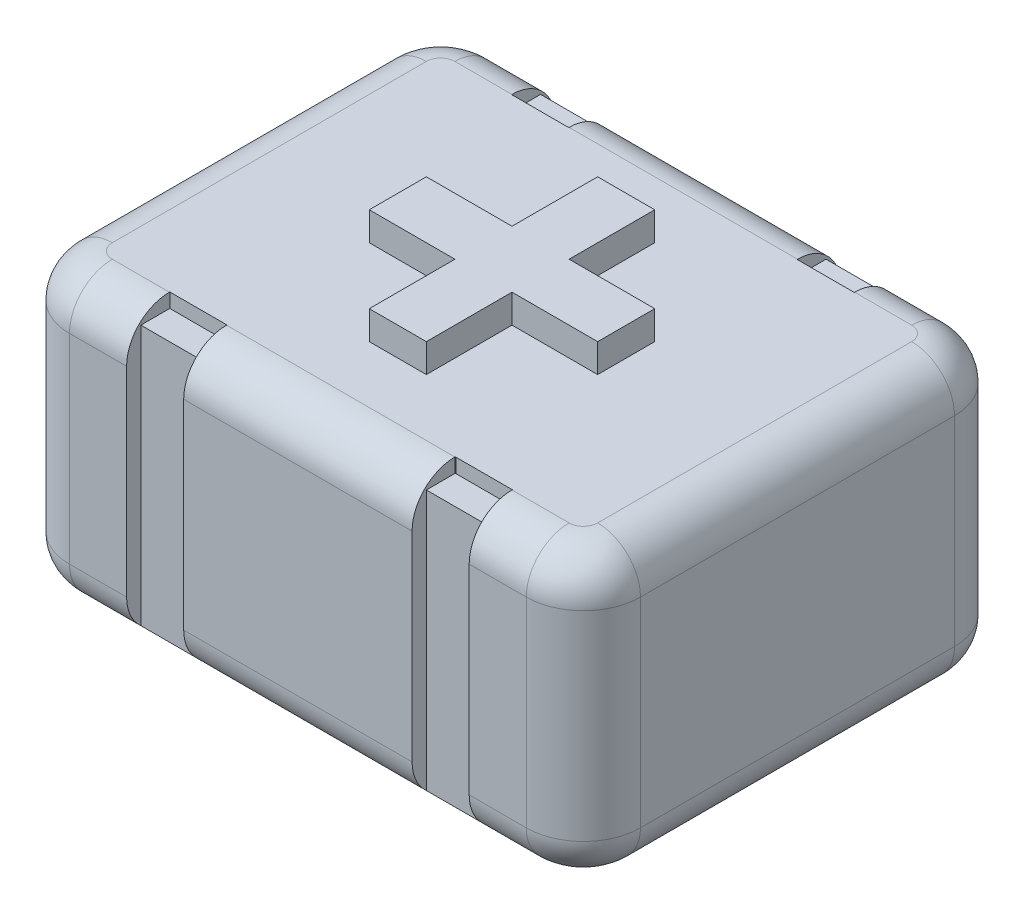
from build123d import *

# Parameters (mm, degrees)
BOSS_EXTRUDE1_DEPTH = 10
SKETCH2_W           = 2
SKETCH2_H           = 0.5
CUT_EXTRUDE1_DEPTH  = 10
CUT_EXTRUDE2_DEPTH  = 0.5
FILLET1_R           = 1.5
FILLET2_R           = 1.5
BOSS_EXTRUDE2_DEPTH = 1


with BuildPart() as part:
    # Sketch1 → Boss-Extrude1 (new body)
    with BuildSketch(Plane(origin=(0, 0, 0), x_dir=(1, 0, 0), z_dir=(0, 1, 0))):
        with BuildLine():
            Line((-8, 7.5), (8, 7.5))
            ThreePointArc((8, 7.5), (9.414213562, 6.914213562), (10, 5.5))
            Line((10, 5.5), (10, -5.5))
            ThreePointArc((10, -5.5), (9.414213562, -6.914213562), (8, -7.5))
            Line((8, -7.5), (-8, -7.5))
            ThreePointArc((-8, -7.5), (-9.414213562, -6.914213562), (-10, -5.5))
            Line((-10, -5.5), (-10, 5.5))
            ThreePointArc((-10, 5.5), (-9.414213562, 6.914213562), (-8, 7.5))
        make_face()
    extrude(amount=BOSS_EXTRUDE1_DEPTH)

    # Sketch2 → Cut-Extrude1 (cut)
    with BuildSketch(Plane(origin=(0, 10, 0), x_dir=(1, 0, 0), z_dir=(0, 1, 0))):
        with Locations((-5, 7.25)):
            Rectangle(SKETCH2_W, SKETCH2_H)
        with Locations((5, 7.25)):
            Rectangle(SKETCH2_W, SKETCH2_H)
        with Locations((5, -7.25)):
            Rectangle(SKETCH2_W, SKETCH2_H)
        with Locations((-5, -7.25)):
            Rectangle(SKETCH2_W, SKETCH2_H)
    extrude(amount=-CUT_EXTRUDE1_DEPTH, mode=Mode.SUBTRACT)

    # Sketch3 → Cut-Extrude2 (cut)
    with BuildSketch(Plane(origin=(0, 10, 0), x_dir=(1, 0, 0), z_dir=(0, 1, 0))):
        Polygon((-6, 7), (-6, 5.986822399), (-4.02260562, 5.986822399), (-4, 6), (-4, 7), align=None)
        Polygon((4, 7), (4, 6), (4.02260562, 5.986822399), (6, 5.986822399), (6, 7), align=None)
        Polygon((6, -7), (4, -7), (4, -6), (4.02260562, -5.986822399), (6, -5.986822399), align=None)
        Polygon((-4, -7), (-4, -6), (-4.02260562, -5.986822399), (-6, -5.986822399), (-6, -7), align=None)
    extrude(amount=-CUT_EXTRUDE2_DEPTH, mode=Mode.SUBTRACT)

    # Fillet1
    fillet1_edges = [part.edges().sort_by_distance(p)[0] for p in [
        (-9.414213562, 10, 6.914213562),
        (-10, 10, 0),
        (-9.414213562, 10, -6.914213562),
        (7, 10, -7.5),
        (-7, 10, -7.5),
        (9.414213562, 10, -6.914213562),
        (10, 10, 0),
        (9.414213562, 10, 6.914213562),
        (7, 10, 7.5),
        (-7, 10, 7.5),
        (0, 10, 7.5),
        (0, 10, -7.5),
    ]]
    fillet(fillet1_edges, radius=FILLET1_R)

    # Fillet2
    # the kernel refuses this fillet: 1.5 mm, written as the material it takes off along each edge
    with BuildSketch(Plane(origin=(2.25, 0, -7.5), x_dir=(0, 0, 1), z_dir=(1, 0, 0)), Plane(origin=(8, 0, 7.5), x_dir=(0, 0, -1), z_dir=(-1, 0, 0)), Plane(origin=(-2.25, 0, 7.5), x_dir=(0, 0, -1), z_dir=(-1, 0, 0))) as fillet2_piece_1:
        with BuildLine():
            CenterArc((FILLET2_R, -FILLET2_R), FILLET2_R, 90, 90)
            Line((0, -FILLET2_R), (0, 0))
            Line((0, 0), (FILLET2_R, 0))
        make_face()
    extrude(amount=5.75, mode=Mode.SUBTRACT)
    with BuildSketch(Plane(origin=(8, 0, -5.5), x_dir=(0, 0, -1), z_dir=(-1, 0, 0))) as fillet2_piece_2:
        with BuildLine():
            CenterArc((2 - FILLET2_R, -FILLET2_R), FILLET2_R, 0, 90)
            Line((2, -FILLET2_R), (2, 0))
            Line((2, 0), (2 - FILLET2_R, 0))
        make_face()
    revolve(axis=Axis((8, 0, -5.5), (0, -1, 0)), revolution_arc=90, mode=Mode.SUBTRACT)
    with BuildSketch(Plane(origin=(10, 0, -5.5), x_dir=(-1, 0, 0), z_dir=(0, 0, 1)), Plane(origin=(-10, 0, 5.5), x_dir=(1, 0, 0), z_dir=(0, 0, -1))) as fillet2_piece_3:
        with BuildLine():
            CenterArc((FILLET2_R, -FILLET2_R), FILLET2_R, 90, 90)
            Line((0, -FILLET2_R), (0, 0))
            Line((0, 0), (FILLET2_R, 0))
        make_face()
    extrude(amount=11, mode=Mode.SUBTRACT)
    with BuildSketch(Plane(origin=(8, 0, 5.5), x_dir=(1, 0, 0), z_dir=(0, 0, -1))) as fillet2_piece_4:
        with BuildLine():
            CenterArc((2 - FILLET2_R, -FILLET2_R), FILLET2_R, 0, 90)
            Line((2, -FILLET2_R), (2, 0))
            Line((2, 0), (2 - FILLET2_R, 0))
        make_face()
    revolve(axis=Axis((8, 0, 5.5), (0, -1, 0)), revolution_arc=90, mode=Mode.SUBTRACT)
    with BuildSketch(Plane(origin=(7.75, 0, 7.5), x_dir=(0, 0, -1), z_dir=(-1, 0, 0)), Plane(origin=(-7.75, 0, -7.5), x_dir=(0, 0, 1), z_dir=(1, 0, 0))) as fillet2_piece_5:
        with BuildLine():
            CenterArc((FILLET2_R, -FILLET2_R), FILLET2_R, 90, 90)
            Line((0, -FILLET2_R), (0, 0))
            Line((0, 0), (FILLET2_R, 0))
        make_face()
    extrude(amount=15.5, mode=Mode.SUBTRACT)
    with BuildSketch(Plane(origin=(-8, 0, -7.5), x_dir=(0, 1, 0), z_dir=(1, 0, 0))) as fillet2_piece_6:
        with BuildLine():
            CenterArc((FILLET2_R, FILLET2_R), FILLET2_R, 180, 90)
            Line((0, FILLET2_R), (0, 0))
            Line((0, 0), (FILLET2_R, 0))
        make_face()
    extrude(amount=5.75, mode=Mode.SUBTRACT)
    with BuildSketch(Plane(origin=(-8, 0, 5.5), x_dir=(0, 0, 1), z_dir=(1, 0, 0))) as fillet2_piece_7:
        with BuildLine():
            CenterArc((2 - FILLET2_R, -FILLET2_R), FILLET2_R, 0, 90)
            Line((2, -FILLET2_R), (2, 0))
            Line((2, 0), (2 - FILLET2_R, 0))
        make_face()
    revolve(axis=Axis((-8, 0, 5.5), (0, -1, 0)), revolution_arc=90, mode=Mode.SUBTRACT)
    with BuildSketch(Plane(origin=(-8, 0, -5.5), x_dir=(-1, 0, 0), z_dir=(0, 0, 1))) as fillet2_piece_8:
        with BuildLine():
            CenterArc((2 - FILLET2_R, -FILLET2_R), FILLET2_R, 0, 90)
            Line((2, -FILLET2_R), (2, 0))
            Line((2, 0), (2 - FILLET2_R, 0))
        make_face()
    revolve(axis=Axis((-8, 0, -5.5), (0, -1, 0)), revolution_arc=90, mode=Mode.SUBTRACT)

    # Sketch4 → Boss-Extrude2 (add)
    with BuildSketch(Plane(origin=(0, 10, 0), x_dir=(1, 0, 0), z_dir=(0, 1, 0))):
        Polygon((-1, 4), (1, 4), (1, 1), (4, 1), (4, -1), (1, -1), (1, -4), (-1, -4), (-1, -1), (-4, -1), (-4, 1), (-1, 1), align=None)
    extrude(amount=BOSS_EXTRUDE2_DEPTH)


solid = part.part
